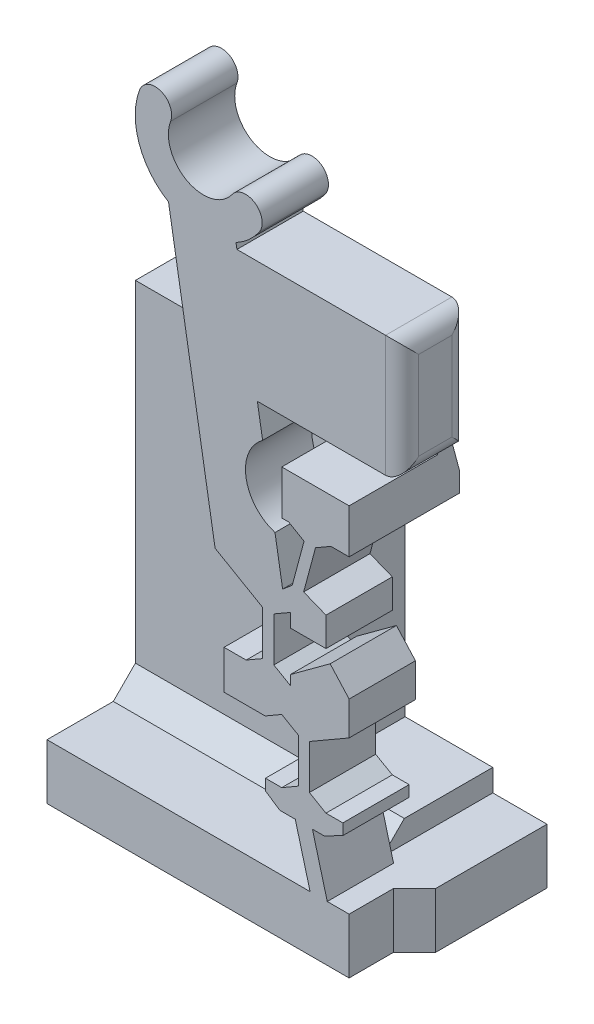
from build123d import *

# Parameters (mm, degrees)
BOSS_SWITCH_BODY_DEPTH                    = 3
SKETCH1_W                                 = 4
SKETCH1_H                                 = 3.5
BOSS_FLANGE_WIDTH_DEPTH                   = 5
BOSS_FLANGE_HEIGHT_REACH                  = 35.863
SKETCH2_W                                 = 4
SKETCH2_H                                 = 2
SKETCH2_W_2                               = 8
SKETCH2_H_2                               = 2.502418954
CUT_UP_TO_DOWN_DERAILLEUR_CLEARANCE_REACH = 21.462
SKETCH10_W                                = 2.453096586
SKETCH10_H                                = 3
SKETCH17_W                                = 12.1675
SKETCH17_H                                = 4
BOSS_FLANGE_SUPPORT_DEPTH                 = 13.997581047
TAP_DRILL_FOR_M2X0_4_TAP1_D               = 1.6
M2_CLEARANCE_HOLE2_D                      = 2.4
M2_CLEARANCE_HOLE2_DEPTH                  = 15
M2_CLEARANCE_HOLE2_TIP                    = 0.721032743
CHAMFER_FLANGE_SUPPORT_SIZE               = 1.5
CHAMFER_FLANGE_SUPPORT_2_SIZE             = 1.5
CHAMFER_FLANGE_SUPPORT_3_SIZE             = 1
SKETCH23_W                                = 3.9675
SKETCH23_H                                = 11.497581046
CUT_GAP_FOR_PRINTING_DEPTH                = 32.000499688
SKETCH25_W                                = 0.953096586
SKETCH25_H                                = 3.5
CUT_DERAILLEUR_CLEARANCE_DEPTH            = 32.145320369
CHAMFER8_SIZE                             = 1
CUT_WIDE_DERAILLEUR_CLEARANCE_DEPTH       = 33.195879702
CUT_WIDE_DERAILLEUR_CLEARANCE_DEPTH_BACK  = 4
SKETCH27_W                                = 2.5
SKETCH27_H                                = 5
CHAMFER9_SIZE                             = 4.5
CHAMFER9_SIZE2                            = 1.205771366
SKETCH28_W                                = 3.046903414
SKETCH28_H                                = 1.5
CUT_EXTRUDE1_DEPTH                        = 1
FILLET1_R                                 = 0.75
CHAMFER10_SIZE                            = 0.75
CHAMFER10_SIZE_2                          = 1.299038106


# Some blends are built 0.0001 mm under size
with BuildPart() as part:
    # Sketch-SwitchBossUp → Boss-Switch Body (new body)
    with BuildSketch(Plane.XY):
        with BuildLine():
            Line((5.581091299, 12.541934627), (5.581101009, 11.23008127))
            Line((5.581101009, 11.23008127), (3.971265267, 11.23008127))
            Line((3.971265267, 11.23008127), (3.97126394, 11.842410935))
            Line((3.97126394, 11.842410935), (3.221271341, 11.409402506))
            Line((3.221271341, 11.409402506), (3.221271341, 9.409402506))
            Line((3.221271341, 9.409402506), (3.971278743, 8.976385531))
            Line((3.971278743, 8.976385531), (3.971278743, 9.409408058))
            Line((3.971278743, 9.409408058), (5.770324648, 10.73008127))
            Line((5.770324648, 10.73008127), (6.627976927, 9.777561915))
            Line((6.627976927, 9.777561915), (6.627976927, 8.253837221))
            Line((6.627976927, 8.253837221), (5.581127512, 7.649438429))
            Line((5.581127512, 7.649438429), (4.831138119, 7.216431851))
            Line((4.831138119, 7.216431851), (4.831138119, 5.216431851))
            Line((4.831138119, 5.216431851), (5.58114552, 4.783414875))
            Line((5.58114552, 4.783414875), (6.344074933, 4.783414875))
            Line((6.344074933, 4.783414875), (6.344074933, 4.283414875))
            Line((6.344074933, 4.283414875), (5.495877173, 3.850416844))
            Line((5.495877173, 3.850416844), (4.969366686, 3.850416844))
            Line((4.969366686, 3.850416844), (5.639239667, 1.350416844))
            Line((5.639239667, 1.350416844), (6.627976927, 1.350416844))
            Line((6.627976927, 1.350416844), (6.627976927, -1.15200211))
            Line((6.627976927, -1.15200211), (2.947962105, -1.15200211))
            Line((2.947962105, -1.15200211), (2.947962105, 1.350416844))
            Line((2.947962105, 1.350416844), (4.862782532, 1.350416844))
            Line((4.862782532, 1.350416844), (4.192909551, 3.850416844))
            Line((4.192909551, 3.850416844), (3.498530635, 3.850416844))
            Line((3.498530635, 3.850416844), (2.844074933, 4.283419721))
            Line((2.844074933, 4.283419721), (2.844074933, 4.783419721))
            Line((2.844074933, 4.783419721), (3.58114552, 4.783419721))
            Line((3.58114552, 4.783419721), (4.331138119, 5.21642815))
            Line((4.331138119, 5.21642815), (4.331138119, 7.21642815))
            Line((4.331138119, 7.21642815), (3.581130717, 7.649445125))
            Line((3.581130717, 7.649445125), (2.83112652, 7.216422599))
            Line((2.83112652, 7.216422599), (0.971281948, 7.216422599))
            Line((0.971281948, 7.216422599), (0.971281948, 8.976392227))
            Line((0.971281948, 8.976392227), (1.971281948, 8.976392227))
            Line((1.971281948, 8.976392227), (2.721271341, 9.409398805))
            Line((2.721271341, 9.409398805), (2.721271341, 11.409398805))
            Line((2.721271341, 11.409398805), (1.688483029, 12.005679416))
            Line((1.688483029, 12.005679416), (0.565243661, 12.654181967))
            Line((0.565243661, 12.654181967), (-1.541303694, 25.167805745))
            ThreePointArc((-1.541303694, 25.167805745), (-2.872284003, 26.795385437), (-2.852546321, 28.897797067))
            ThreePointArc((-2.852546321, 28.897797067), (-1.887813913, 29.338582026), (-1.447028953, 28.373849618))
            ThreePointArc((-1.447028953, 28.373849618), (-0.703448682, 26.416936722), (1.333779254, 26.898727173))
            ThreePointArc((1.333779254, 26.898727173), (2.379722745, 27.074801628), (2.555797201, 26.028858137))
            ThreePointArc((2.555797201, 26.028858137), (2.086504637, 25.507104397), (1.511513111, 25.104801997))
            Line((1.511513111, 25.104801997), (1.553598189, 24.854801997))
            Line((1.553598189, 24.854801997), (9.027976927, 24.854801997))
            Line((9.027976927, 24.854801997), (9.027976927, 22.368110011))
            Line((9.027976927, 22.368110011), (9.027976927, 19.368110011))
            Line((9.027976927, 19.368110011), (2.477229641, 19.368110011))
            Line((2.477229641, 19.368110011), (2.715215909, 17.954388823))
            ThreePointArc((2.715215909, 17.954388823), (1.96529156, 16.116657159), (3.275561815, 14.625739302))
            Line((3.275561815, 14.625739302), (3.620297651, 12.577888564))
            Line((3.620297651, 12.577888564), (4.054320079, 12.944956709))
            Line((4.054320079, 12.944956709), (4.59020366, 14.944960676))
            Line((4.59020366, 14.944960676), (3.892110795, 15.34799789))
            Line((3.892110795, 15.34799789), (3.581073513, 15.34799789))
            Line((3.581073513, 15.34799789), (3.581073513, 17.34799789))
            Line((3.581073513, 17.34799789), (5.639078341, 17.34799789))
            Line((5.639078341, 17.34799789), (6.627976927, 17.34799789))
            Line((6.627976927, 17.34799789), (6.627976927, 15.34799789))
            Line((6.627976927, 15.34799789), (5.805904115, 15.34799789))
            Line((5.805904115, 15.34799789), (5.107841751, 14.944964507))
            Line((5.107841751, 14.944964507), (4.571958169, 12.944960541))
            Line((4.571958169, 12.944960541), (5.581091299, 12.541934627))
        make_face()
    extrude(amount=BOSS_SWITCH_BODY_DEPTH)

    # Sketch1 → Boss-Flange Width (add)
    with BuildSketch(Plane(origin=(0, 0, 0), x_dir=(-1, 0, 0), z_dir=(0, 0, -1))):
        Polygon((-7.581073513, -1.15200211), (0.412170615, -1.15200211), (0.412170615, 1.350416844), (-2.947962105, 1.350416844), (-4.862782532, 1.350416844), (-5.639239667, 1.350416844), (-6.627976927, 1.350416844), (-7.581073513, 1.350416844), align=None)
        with Locations((-5.581073513, 17.09799789)):
            Rectangle(SKETCH1_W, SKETCH1_H)
    extrude(amount=BOSS_FLANGE_WIDTH_DEPTH)

    # Sketch2 → Boss-Flange Height (add, up to next)
    with BuildSketch(Plane(origin=(-7.039523073, 0, 0), x_dir=(0, 0, -1), z_dir=(1, 0, 0)), mode=Mode.PRIVATE) as boss_flange_height_sk1:
        with Locations((3, 16.34799789)):
            Rectangle(SKETCH2_W, SKETCH2_H)
    boss_flange_height_tool1 = extrude(boss_flange_height_sk1.sketch, amount=BOSS_FLANGE_HEIGHT_REACH, mode=Mode.PRIVATE) - part.part
    # Sketch2 → Boss-Flange Height (add, up to next)
    with BuildSketch(Plane(origin=(-7.039523073, 0, 0), x_dir=(0, 0, -1), z_dir=(1, 0, 0)), mode=Mode.PRIVATE) as boss_flange_height_sk2:
        with Locations((1, 0.099207367)):
            Rectangle(SKETCH2_W_2, SKETCH2_H_2)
    boss_flange_height_tool2 = extrude(boss_flange_height_sk2.sketch, amount=BOSS_FLANGE_HEIGHT_REACH, mode=Mode.PRIVATE) - part.part
    add(boss_flange_height_tool1.solids().sort_by_distance((-7.039523, 16.347998, -3))[0])
    add(boss_flange_height_tool2.solids().sort_by_distance((-7.039523, 0.099207, -1))[0])

    # Sketch10 → Cut-Up-To-Down Derailleur Clearance (cut, up to next)
    with BuildSketch(Plane(origin=(0, 15.34799789, 0), x_dir=(1, 0, 0), z_dir=(0, 1, 0)), mode=Mode.PRIVATE) as cut_up_to_down_derailleur_clearance_sk1:
        with Locations((6.35452522, 3.5)):
            Rectangle(SKETCH10_W, SKETCH10_H)
    cut_up_to_down_derailleur_clearance_tool1 = extrude(cut_up_to_down_derailleur_clearance_sk1.sketch, amount=CUT_UP_TO_DOWN_DERAILLEUR_CLEARANCE_REACH, mode=Mode.PRIVATE) & part.part
    add(cut_up_to_down_derailleur_clearance_tool1.solids().sort_by_distance((6.354525, 15.347998, -3.5))[0], mode=Mode.SUBTRACT)

    # Sketch17 → Boss-Flange Support (add)
    with BuildSketch(Plane.XZ.offset(-15.34799789)):
        with Locations((-0.955773073, -3)):
            Rectangle(SKETCH17_W, SKETCH17_H)
    extrude(amount=BOSS_FLANGE_SUPPORT_DEPTH)

    # Tap Drill for M2x0.4 Tap1 (through all)
    with Locations(Plane(origin=(0, -1.15200211, 0), x_dir=(-1, 0, 0), z_dir=(0, -1, 0))):
        with Locations((5.039523073, 3), (0.539523073, 3)):
            Hole(TAP_DRILL_FOR_M2X0_4_TAP1_D / 2)

    # M2 Clearance Hole2
    with Locations(Plane.XZ.offset(1.15200211)):
        with Locations((-5.039523073, -3), (-0.539523073, -3)):
            Hole(M2_CLEARANCE_HOLE2_D / 2, depth=M2_CLEARANCE_HOLE2_DEPTH)
            with Locations((0, 0, -(M2_CLEARANCE_HOLE2_DEPTH + M2_CLEARANCE_HOLE2_TIP / 2))):  # 118° drill point
                Cone(0, M2_CLEARANCE_HOLE2_D / 2, M2_CLEARANCE_HOLE2_TIP, mode=Mode.SUBTRACT)

    # Chamfer-Flange Support
    chamfer_flange_support_edges = [part.edges().sort_by_distance(p)[0] for p in [
        (3.581073513, 17.34799789, -3),
    ]]
    chamfer(chamfer_flange_support_edges, length=CHAMFER_FLANGE_SUPPORT_SIZE - 0.0001)  # a hair under: the kernel refuses the full size

    # Chamfer-Flange Support 2
    chamfer_flange_support_2_edges = [part.edges().sort_by_distance(p)[0] for p in [
        (5.127976927, 17.09799789, -2),
        (5.127976927, 15.34799789, -1.5),
    ]]
    chamfer(chamfer_flange_support_2_edges, length=CHAMFER_FLANGE_SUPPORT_2_SIZE)

    # Chamfer-Flange Support 3
    chamfer_flange_support_3_edges = [part.edges().sort_by_distance(p)[0] for p in [
        (-0.955773073, 1.350416843, -1),
    ]]
    chamfer(chamfer_flange_support_3_edges, length=CHAMFER_FLANGE_SUPPORT_3_SIZE - 0.0001)  # a hair under: the kernel refuses the full size

    # Sketch23 → Cut-Gap for Printing (cut, through all)
    with BuildSketch(Plane.XY.offset(-1)):
        with Locations((3.144226927, 8.099207367)):
            Rectangle(SKETCH23_W, SKETCH23_H)
    extrude(amount=-CUT_GAP_FOR_PRINTING_DEPTH, mode=Mode.SUBTRACT)

    # Sketch25 → Cut-Derailleur Clearance (cut, through all)
    with BuildSketch(Plane.XY):
        with Locations((7.10452522, 17.09799789)):
            Rectangle(SKETCH25_W, SKETCH25_H)
    extrude(amount=-CUT_DERAILLEUR_CLEARANCE_DEPTH, mode=Mode.SUBTRACT)

    # Chamfer8
    # the kernel refuses this chamfer: 1 mm, written as the material it adds along each edge
    with BuildSketch(Plane(origin=(6.627976927, 1.350416844, 0), x_dir=(0.9996219169112968, 0, -0.027495876610586365), z_dir=(0, -1, 0))) as chamfer8_piece_1_section:
        Polygon((CHAMFER8_SIZE * 0.999621916911, CHAMFER8_SIZE * 0.0274958766106), (-CHAMFER8_SIZE * 0.0274958766106, CHAMFER8_SIZE * 0.999621916911), (0, 0), align=None)
    chamfer8_piece_1 = extrude(amount=2.502418953, mode=Mode.PRIVATE)
    chamfer8_piece_1 = split(chamfer8_piece_1, bisect_by=Plane(origin=(7.581073513, 0.099207367, 0.332375145), z_dir=(-1, 0, 0)), keep=Keep.TOP, mode=Mode.PRIVATE)
    add(chamfer8_piece_1)

    # Sketch27 → Cut-Wide Derailleur Clearance (cut, two sides: drawn at the far end of the back side and taken through both)
    with BuildSketch(Plane(origin=(5.127976927, 0, 0), x_dir=(0, 0, -1), z_dir=(1, 0, 0)).offset(-CUT_WIDE_DERAILLEUR_CLEARANCE_DEPTH_BACK)):
        with Locations((3.75, 16.34799789)):
            Rectangle(SKETCH27_W, SKETCH27_H)
    extrude(amount=CUT_WIDE_DERAILLEUR_CLEARANCE_DEPTH + CUT_WIDE_DERAILLEUR_CLEARANCE_DEPTH_BACK, mode=Mode.SUBTRACT)

    # Chamfer9
    chamfer9_edges = [part.edges().sort_by_distance(p)[0] for p in [
        (4.85452522, 18.84799789, -2.5),
    ]]
    chamfer9_side = [part.faces().sort_by_distance(p)[0] for p in [
        (3.764105521, 16.180817512, -2.5),
    ]]
    chamfer(chamfer9_edges, length=CHAMFER9_SIZE, length2=CHAMFER9_SIZE2, reference=chamfer9_side[0])

    # Sketch28 → Cut-Extrude1 (cut)
    with BuildSketch(Plane.XY.offset(-1)):
        with Locations((5.10452522, 18.09799789)):
            Rectangle(SKETCH28_W, SKETCH28_H)
    extrude(amount=CUT_EXTRUDE1_DEPTH, mode=Mode.SUBTRACT)

    # Fillet1
    fillet1_edges = [part.edges().sort_by_distance(p)[0] for p in [
        (9.027976927, 24.854801997, 1.5),
        (9.027976927, 19.368110011, 1.5),
        (9.027976927, 22.111456004, 3),
        (9.027976927, 22.111456004, 0),
    ]]
    fillet(fillet1_edges, radius=FILLET1_R)

    # Chamfer10
    # the kernel refuses this chamfer: 1.299038106, 0.75 mm, written as the material it takes off along each edge
    with BuildSketch(Plane(origin=(-2.200246051, 13.84799789, -2.5), x_dir=(0, -0.0578938624026709, 0.9983227437537926), z_dir=(1, 0, 0))) as chamfer10_piece_1_section:
        Polygon((CHAMFER10_SIZE * 0.998322743754, -CHAMFER10_SIZE * 0.0578938624027), (-CHAMFER10_SIZE_2 * 0.0578938623883, -CHAMFER10_SIZE_2 * 0.998322743505), (0, 0), align=None)
    chamfer10_piece_1 = extrude(amount=10.688945956, mode=Mode.PRIVATE)
    chamfer10_piece_1 = split(chamfer10_piece_1, bisect_by=Plane(origin=(1.127976927, 14.210794695, -2.222573912), z_dir=(1, 0, 0)), keep=Keep.TOP, mode=Mode.PRIVATE)
    add(chamfer10_piece_1, mode=Mode.SUBTRACT)


solid = part.part
